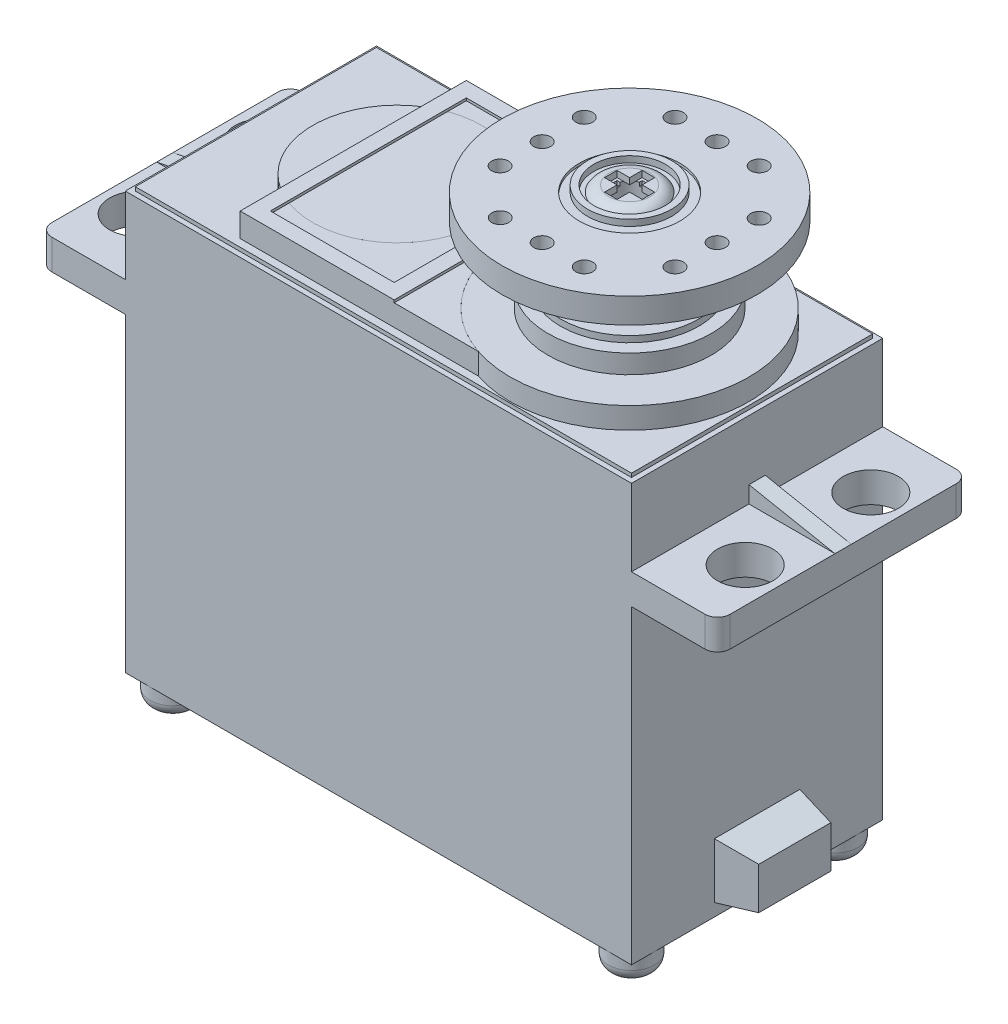
from build123d import *

# Parameters (mm, degrees)
CROQUIS1_W                    = 40.3
CROQUIS1_H                    = 20
SALIENTE_EXTRUIR1_DEPTH       = 35.5
CROQUIS2_W                    = 20
CROQUIS2_H                    = 2.4
SALIENTE_EXTRUIR2_DEPTH       = 6.85
CROQUIS3_W                    = 20
CROQUIS3_H                    = 2.4
SALIENTE_EXTRUIR3_DEPTH       = 6.85
REDONDEO1_R                   = 1
REDONDEO2_R                   = 1
REDONDEO3_R                   = 1
REDONDEO4_R                   = 1
SALIENTE_EXTRUIR4_DEPTH       = 1.5
CHAFL_N1_SIZE                 = 7.716831024
CHAFL_N1_SIZE_2               = 1.5
SALIENTE_EXTRUIR5_DEPTH       = 1.5
CHAFL_N2_SIZE                 = 1.5
CHAFL_N2_SIZE_2               = 7.716831024
CROQUIS6_R                    = 2.2
CORTAR_EXTRUIR1_DEPTH         = 2.6
CROQUIS7_R                    = 2.2
CORTAR_EXTRUIR2_DEPTH         = 2.6
CROQUIS8_W                    = 40.3
CROQUIS8_H                    = 20
CROQUIS8_W_2                  = 39.5
CROQUIS8_H_2                  = 19.2
CORTAR_EXTRUIR3_DEPTH         = 0.3
CROQUIS9_W                    = 3.8
CROQUIS9_H                    = 3.8
CORTAR_EXTRUIR4_DEPTH         = 2
REDONDEO5_R                   = 2
REDONDEO6_R                   = 2
REDONDEO7_R                   = 2
REDONDEO8_R                   = 2
CROQUIS10_R                   = 1.825
SALIENTE_EXTRUIR6_DEPTH       = 2
REDONDEO9_R                   = 1
REDONDEO10_R                  = 1
REDONDEO11_R                  = 1
REDONDEO12_R                  = 1
CORTAR_EXTRUIR5_DEPTH         = 1
CHAFL_N3_SIZE                 = 2
CHAFL_N4_SIZE                 = 2
CHAFL_N5_SIZE                 = 2
CHAFL_N6_SIZE                 = 2
SALIENTE_EXTRUIR7_DEPTH       = 2.0001
SALIENTE_EXTRUIR8_DEPTH       = 0.0001
SALIENTE_EXTRUIR8_DEPTH_BACK  = 2
CROQUIS13_R                   = 9.5
CROQUIS14_R                   = 6.5
SALIENTE_EXTRUIR9_DEPTH       = 1.5
CROQUIS15_R                   = 5.5
SALIENTE_EXTRUIR10_DEPTH      = 0.5
CROQUIS16_R                   = 2.9
SALIENTE_EXTRUIR11_DEPTH      = 4
CROQUIS17_R                   = 0.85
CORTAR_EXTRUIR6_DEPTH         = 4
CROQUIS18_W                   = 6.8
CROQUIS18_H                   = 4.4
SALIENTE_EXTRUIR12_DEPTH      = 3
CHAFL_N7_SIZE2                = 0.528980942
CHAFL_N7_SIZE                 = 3
CHAFL_N8_SIZE2                = 3
CHAFL_N8_SIZE                 = 0.528980942
CHAFL_N9_SIZE2                = 3
CHAFL_N9_SIZE                 = 0.528980942
CHAFL_N10_SIZE2               = 3
CHAFL_N10_SIZE                = 0.528980942
SALIENTE_EXTRUIR13_DEPTH      = 0.0001
SALIENTE_EXTRUIR13_DEPTH_BACK = 2
CROQUIS19_R                   = 6.714911356
CROQUIS20_W                   = 9.858170172
CROQUIS20_H                   = 15.6
SALIENTE_EXTRUIR14_DEPTH      = 0.2
SALIENTE_EXTRUIR15_DEPTH      = 2
SALIENTE_EXTRUIR15_DEPTH_BACK = 3
CROQUIS21_R                   = 4.3
SALIENTE_EXTRUIR16_DEPTH      = 0.0001
SALIENTE_EXTRUIR16_DEPTH_BACK = 2
CROQUIS22_R                   = 10.15
CROQUIS23_R                   = 1.375
CORTAR_EXTRUIR7_DEPTH         = 5.2
CROQUIS24_R                   = 3.35
CROQUIS24_R_2                 = 2.85
SALIENTE_EXTRUIR17_DEPTH      = 0.5
CHAFL_N11_SIZE                = 0.75
CROQUIS25_R                   = 2.5
SALIENTE_EXTRUIR18_DEPTH      = 0.5
REDONDEO13_R                  = 1
CROQUIS27_W                   = 1
CROQUIS27_H                   = 1
CORTAR_EXTRUIR8_DEPTH         = 1
CROQUIS28_R                   = 4
CORTAR_EXTRUIR10_DEPTH        = 0.2
CROQUIS29_R                   = 0.675
CORTAR_EXTRUIR11_DEPTH        = 2.5
CROQUIS30_R                   = 0.675
CORTAR_EXTRUIR12_DEPTH        = 2.5


# Some blends are built 0.0001 mm under size
with BuildPart() as part:
    # Croquis1 → Saliente-Extruir1 (new body)
    with BuildSketch(Plane(origin=(0, 0, 0), x_dir=(1, 0, 0), z_dir=(0, 1, 0))):
        Rectangle(CROQUIS1_W, CROQUIS1_H)
    extrude(amount=SALIENTE_EXTRUIR1_DEPTH)

    # Croquis2 → Saliente-Extruir2 (add)
    with BuildSketch(Plane(origin=(20.15, 0, 0), x_dir=(0, 0, -1), z_dir=(1, 0, 0))):
        with Locations((0, 27.9)):
            Rectangle(CROQUIS2_W, CROQUIS2_H)
    extrude(amount=SALIENTE_EXTRUIR2_DEPTH)

    # Croquis3 → Saliente-Extruir3 (add)
    with BuildSketch(Plane.ZY.offset(20.15)):
        with Locations((0, 27.9)):
            Rectangle(CROQUIS3_W, CROQUIS3_H)
    extrude(amount=SALIENTE_EXTRUIR3_DEPTH)

    # Redondeo1
    redondeo1_edges = [part.edges().sort_by_distance(p)[0] for p in [
        (27, 27.9, 10),
    ]]
    fillet(redondeo1_edges, radius=REDONDEO1_R)

    # Redondeo2
    redondeo2_edges = [part.edges().sort_by_distance(p)[0] for p in [
        (27, 27.9, -10),
    ]]
    fillet(redondeo2_edges, radius=REDONDEO2_R)

    # Redondeo3
    redondeo3_edges = [part.edges().sort_by_distance(p)[0] for p in [
        (-27, 27.9, 10),
    ]]
    fillet(redondeo3_edges, radius=REDONDEO3_R)

    # Redondeo4
    redondeo4_edges = [part.edges().sort_by_distance(p)[0] for p in [
        (-27, 27.9, -10),
    ]]
    fillet(redondeo4_edges, radius=REDONDEO4_R)

    # Croquis4 → Saliente-Extruir4 (add)
    with BuildSketch(Plane(origin=(0, 29.1, 0), x_dir=(1, 0, 0), z_dir=(0, 1, 0))):
        Polygon((20.15, 0), (20.15, 0.65), (27, 0.65), (27, 0), (27, -0.65), (20.15, -0.65), align=None)
    extrude(amount=SALIENTE_EXTRUIR4_DEPTH)

    # Chaflán1
    # the kernel refuses this chamfer: 7.716831024, 1.5 mm, written as the material it takes off along each edge
    with BuildSketch(Plane(origin=(27, 30.6, -20.700123343), x_dir=(-0.9999730339438945, 0.007343799087842641, 0), z_dir=(0, 0, 1))) as chafl_n1_piece_1_section:
        Polygon((CHAFL_N1_SIZE * 0.999973033938, CHAFL_N1_SIZE * 0.0073437990878), (-CHAFL_N1_SIZE_2 * 0.00734379908784, CHAFL_N1_SIZE_2 * 0.999973033944), (0, 0), align=None)
    chafl_n1_piece_1 = extrude(amount=41.400246686, mode=Mode.PRIVATE)
    chafl_n1_piece_1 = split(chafl_n1_piece_1, bisect_by=Plane(origin=(20.15, 30.164831882, 0), z_dir=(1, 0, 0)), keep=Keep.TOP, mode=Mode.PRIVATE)
    add(chafl_n1_piece_1, mode=Mode.SUBTRACT)

    # Croquis5 → Saliente-Extruir5 (add)
    with BuildSketch(Plane(origin=(0, 29.1, 0), x_dir=(1, 0, 0), z_dir=(0, 1, 0))):
        Polygon((-27, 0), (-27, 0.65), (-20.15, 0.65), (-20.15, 0), (-20.15, -0.65), (-27, -0.65), align=None)
    extrude(amount=SALIENTE_EXTRUIR5_DEPTH)

    # Chaflán2
    # the kernel refuses this chamfer: 7.716831024, 1.5 mm, written as the material it takes off along each edge
    with BuildSketch(Plane(origin=(-27, 30.6, 20.700123343), x_dir=(-0.19079870499623633, -0.9816291836389947, 0), z_dir=(0, 0, -1))) as chafl_n2_piece_1_section:
        Polygon((CHAFL_N2_SIZE * 0.981629183639, -CHAFL_N2_SIZE * 0.190798704996), (-CHAFL_N2_SIZE_2 * 0.190798704995, -CHAFL_N2_SIZE_2 * 0.981629183633), (0, 0), align=None)
    chafl_n2_piece_1 = extrude(amount=41.400246686, mode=Mode.PRIVATE)
    chafl_n2_piece_1 = split(chafl_n2_piece_1, bisect_by=Plane(origin=(-20.15, 30.164831882, 0), z_dir=(-1, 0, 0)), keep=Keep.TOP, mode=Mode.PRIVATE)
    add(chafl_n2_piece_1, mode=Mode.SUBTRACT)

    # Croquis6 → Cortar-Extruir1 (cut)
    with BuildSketch(Plane(origin=(0, 29.1, 0), x_dir=(1, 0, 0), z_dir=(0, 1, 0))):
        with Locations(Location((24.2, 5, 0), (0, 0, 270))):
            Circle(CROQUIS6_R)
        with Locations(Location((24.2, -5, 0), (0, 0, 270))):
            Circle(CROQUIS6_R)
    extrude(amount=-CORTAR_EXTRUIR1_DEPTH, mode=Mode.SUBTRACT)

    # Croquis7 → Cortar-Extruir2 (cut)
    with BuildSketch(Plane(origin=(0, 29.1, 0), x_dir=(1, 0, 0), z_dir=(0, 1, 0))):
        with Locations(Location((-24.2, -5, 0), (0, 0, 270))):
            Circle(CROQUIS7_R)
        with Locations(Location((-24.2, 5, 0), (0, 0, 270))):
            Circle(CROQUIS7_R)
    extrude(amount=-CORTAR_EXTRUIR2_DEPTH, mode=Mode.SUBTRACT)

    # Croquis8 → Cortar-Extruir3 (cut)
    with BuildSketch(Plane(origin=(0, 35.5, 0), x_dir=(1, 0, 0), z_dir=(0, 1, 0))):
        Rectangle(CROQUIS8_W, CROQUIS8_H)
        Rectangle(CROQUIS8_W_2, CROQUIS8_H_2, mode=Mode.SUBTRACT)
    extrude(amount=-CORTAR_EXTRUIR3_DEPTH, mode=Mode.SUBTRACT)

    # Croquis9 → Cortar-Extruir4 (cut)
    with BuildSketch(Plane.XZ):
        with Locations((-18.25, -8.1)):
            Rectangle(CROQUIS9_W, CROQUIS9_H)
        with Locations((-18.25, 8.1)):
            Rectangle(CROQUIS9_W, CROQUIS9_H)
        with Locations((18.25, 8.1)):
            Rectangle(CROQUIS9_W, CROQUIS9_H)
        with Locations((18.25, -8.1)):
            Rectangle(CROQUIS9_W, CROQUIS9_H)
    extrude(amount=-CORTAR_EXTRUIR4_DEPTH, mode=Mode.SUBTRACT)

    # Redondeo5
    redondeo5_edges = [part.edges().sort_by_distance(p)[0] for p in [
        (-16.35, 1, -6.2),
    ]]
    fillet(redondeo5_edges, radius=REDONDEO5_R)

    # Redondeo6
    redondeo6_edges = [part.edges().sort_by_distance(p)[0] for p in [
        (-16.35, 1, 6.2),
    ]]
    fillet(redondeo6_edges, radius=REDONDEO6_R)

    # Redondeo7
    redondeo7_edges = [part.edges().sort_by_distance(p)[0] for p in [
        (16.35, 1, 6.2),
    ]]
    fillet(redondeo7_edges, radius=REDONDEO7_R)

    # Redondeo8
    redondeo8_edges = [part.edges().sort_by_distance(p)[0] for p in [
        (16.35, 1, -6.2),
    ]]
    fillet(redondeo8_edges, radius=REDONDEO8_R)

    # Croquis10 → Saliente-Extruir6 (add)
    with BuildSketch(Plane.XZ.offset(-2)):
        with Locations(Location((-18.25, 8.1, 0), (0, 0, 270))):
            Circle(CROQUIS10_R)
        with Locations(Location((-18.25, -8.1, 0), (0, 0, 90))):
            Circle(CROQUIS10_R)
        with Locations(Location((18.25, -8.1, 0), (0, 0, 90))):
            Circle(CROQUIS10_R)
        with Locations(Location((18.25, 8.1, 0), (0, 0, 270))):
            Circle(CROQUIS10_R)
    extrude(amount=SALIENTE_EXTRUIR6_DEPTH)

    # Redondeo9
    redondeo9_edges = [part.edges().sort_by_distance(p)[0] for p in [
        (-18.25, 0, -9.925),
    ]]
    fillet(redondeo9_edges, radius=REDONDEO9_R)

    # Redondeo10
    redondeo10_edges = [part.edges().sort_by_distance(p)[0] for p in [
        (-18.25, 0, 9.925),
    ]]
    fillet(redondeo10_edges, radius=REDONDEO10_R)

    # Redondeo11
    redondeo11_edges = [part.edges().sort_by_distance(p)[0] for p in [
        (18.25, 0, -9.925),
    ]]
    fillet(redondeo11_edges, radius=REDONDEO11_R)

    # Redondeo12
    redondeo12_edges = [part.edges().sort_by_distance(p)[0] for p in [
        (18.25, 0, 9.925),
    ]]
    fillet(redondeo12_edges, radius=REDONDEO12_R)

    # Croquis11 → Cortar-Extruir5 (cut)
    with BuildSketch(Plane.XZ):
        Polygon((-18.75, -9.35), (-17.75, -9.35), (-17.75, -8.6), (-17, -8.6), (-17, -7.6), (-17.75, -7.6), (-17.75, -6.85), (-18.75, -6.85), (-18.75, -7.6), (-19.5, -7.6), (-19.5, -8.6), (-18.75, -8.6), align=None)
        Polygon((-18.75, 9.35), (-17.75, 9.35), (-17.75, 8.6), (-17, 8.6), (-17, 7.6), (-17.75, 7.6), (-17.75, 6.85), (-18.75, 6.85), (-18.75, 7.6), (-19.5, 7.6), (-19.5, 8.6), (-18.75, 8.6), align=None)
        Polygon((18.75, 6.85), (17.75, 6.85), (17.75, 7.6), (17, 7.6), (17, 8.6), (17.75, 8.6), (17.75, 9.35), (18.75, 9.35), (18.75, 8.6), (19.5, 8.6), (19.5, 7.6), (18.75, 7.6), align=None)
        Polygon((18.75, -6.85), (17.75, -6.85), (17.75, -7.6), (17, -7.6), (17, -8.6), (17.75, -8.6), (17.75, -9.35), (18.75, -9.35), (18.75, -8.6), (19.5, -8.6), (19.5, -7.6), (18.75, -7.6), align=None)
    extrude(amount=-CORTAR_EXTRUIR5_DEPTH, mode=Mode.SUBTRACT)

    # Chaflán3
    chafl_n3_edges = [part.edges().sort_by_distance(p)[0] for p in [
        (0, 0, -10),
    ]]
    chamfer(chafl_n3_edges, length=CHAFL_N3_SIZE)

    # Chaflán4
    chafl_n4_edges = [part.edges().sort_by_distance(p)[0] for p in [
        (20.15, 0, 0),
    ]]
    chamfer(chafl_n4_edges, length=CHAFL_N4_SIZE)

    # Chaflán5
    chafl_n5_edges = [part.edges().sort_by_distance(p)[0] for p in [
        (0, 0, 10),
    ]]
    chamfer(chafl_n5_edges, length=CHAFL_N5_SIZE)

    # Chaflán6
    chafl_n6_edges = [part.edges().sort_by_distance(p)[0] for p in [
        (-20.15, 0, 0),
    ]]
    chamfer(chafl_n6_edges, length=CHAFL_N6_SIZE)

    # Croquis12 → Saliente-Extruir7 (add)
    with BuildSketch(Plane(origin=(0, 35.2, 0), x_dir=(1, 0, 0), z_dir=(0, 1, 0))):
        Polygon((0, 9), (-12, 9), (-12, -9), (0, -9), (10, -9), (10, 9), align=None)
    extrude(amount=SALIENTE_EXTRUIR7_DEPTH)

    # Croquis13 → Saliente-Extruir8 (add, two sides: drawn at the far end of the back side and taken through both)
    with BuildSketch(Plane(origin=(0, 37.2001, 0), x_dir=(1, 0, 0), z_dir=(0, 1, 0)).offset(-SALIENTE_EXTRUIR8_DEPTH_BACK)):
        with Locations(Location((10, 0, 0), (0, 0, 270))):
            Circle(CROQUIS13_R)
    extrude(amount=SALIENTE_EXTRUIR8_DEPTH + SALIENTE_EXTRUIR8_DEPTH_BACK)

    # Croquis14 → Saliente-Extruir9 (add)
    with BuildSketch(Plane(origin=(0, 37.2002, 0), x_dir=(1, 0, 0), z_dir=(0, 1, 0))):
        with Locations(Location((10, 0, 0), (0, 0, 270))):
            Circle(CROQUIS14_R)
    extrude(amount=SALIENTE_EXTRUIR9_DEPTH)

    # Croquis15 → Saliente-Extruir10 (add)
    with BuildSketch(Plane(origin=(0, 38.7002, 0), x_dir=(1, 0, 0), z_dir=(0, 1, 0))):
        with Locations(Location((10, 0, 0), (0, 0, 270))):
            Circle(CROQUIS15_R)
    extrude(amount=SALIENTE_EXTRUIR10_DEPTH)

    # Croquis16 → Saliente-Extruir11 (add)
    with BuildSketch(Plane(origin=(0, 39.2002, 0), x_dir=(1, 0, 0), z_dir=(0, 1, 0))):
        with Locations(Location((10, 0, 0), (0, 0, 270))):
            Circle(CROQUIS16_R)
    extrude(amount=SALIENTE_EXTRUIR11_DEPTH)

    # Croquis17 → Cortar-Extruir6 (cut)
    with BuildSketch(Plane(origin=(0, 43.2002, 0), x_dir=(1, 0, 0), z_dir=(0, 1, 0))):
        with Locations(Location((10, 0, 0), (0, 0, 270))):
            Circle(CROQUIS17_R)
    extrude(amount=-CORTAR_EXTRUIR6_DEPTH, mode=Mode.SUBTRACT)

    # Croquis18 → Saliente-Extruir12 (add)
    with BuildSketch(Plane(origin=(20.15, 0, 0), x_dir=(0, 0, -1), z_dir=(1, 0, 0))):
        with Locations((0, 5.2)):
            Rectangle(CROQUIS18_W, CROQUIS18_H)
    extrude(amount=SALIENTE_EXTRUIR12_DEPTH)

    # Chaflán7
    chafl_n7_edges = [part.edges().sort_by_distance(p)[0] for p in [
        (23.15, 7.4, 0),
    ]]
    chafl_n7_side = [part.faces().sort_by_distance(p)[0] for p in [
        (23.139420381, 7.4, 0),
    ]]
    chamfer(chafl_n7_edges, length=CHAFL_N7_SIZE - 0.0001, length2=CHAFL_N7_SIZE2 - 0.0001, reference=chafl_n7_side[0])  # a hair under: the kernel refuses the full size

    # Chaflán8
    chafl_n8_edges = [part.edges().sort_by_distance(p)[0] for p in [
        (23.15, 3, 0),
    ]]
    chafl_n8_side = [part.faces().sort_by_distance(p)[0] for p in [
        (23.15, 3.010579619, 0),
    ]]
    chamfer(chafl_n8_edges, length=CHAFL_N8_SIZE - 0.0001, length2=CHAFL_N8_SIZE2 - 0.0001, reference=chafl_n8_side[0])  # a hair under: the kernel refuses the full size

    # Chaflán9
    chafl_n9_edges = [part.edges().sort_by_distance(p)[0] for p in [
        (23.15, 5.2, -3.4),
    ]]
    chafl_n9_side = [part.faces().sort_by_distance(p)[0] for p in [
        (23.15, 5.2, -3.389420381),
    ]]
    chamfer(chafl_n9_edges, length=CHAFL_N9_SIZE - 0.0001, length2=CHAFL_N9_SIZE2 - 0.0001, reference=chafl_n9_side[0])  # a hair under: the kernel refuses the full size

    # Chaflán10
    chafl_n10_edges = [part.edges().sort_by_distance(p)[0] for p in [
        (23.15, 5.2, 3.4),
    ]]
    chafl_n10_side = [part.faces().sort_by_distance(p)[0] for p in [
        (23.15, 5.2, 3.389420381),
    ]]
    chamfer(chafl_n10_edges, length=CHAFL_N10_SIZE - 0.0001, length2=CHAFL_N10_SIZE2 - 0.0001, reference=chafl_n10_side[0])  # a hair under: the kernel refuses the full size

    # Croquis19 → Saliente-Extruir13 (add, two sides: drawn at the far end of the back side and taken through both)
    with BuildSketch(Plane(origin=(0, 37.2001, 0), x_dir=(1, 0, 0), z_dir=(0, 1, 0)).offset(-SALIENTE_EXTRUIR13_DEPTH_BACK)):
        with Locations(Location((-8.5, 0, 0), (0, 0, 270))):
            Circle(CROQUIS19_R)
    extrude(amount=SALIENTE_EXTRUIR13_DEPTH + SALIENTE_EXTRUIR13_DEPTH_BACK)

    # Croquis20 → Saliente-Extruir14 (add)
    with BuildSketch(Plane(origin=(0, 37.2001, 0), x_dir=(1, 0, 0), z_dir=(0, 1, 0))):
        Polygon((0.258170172, -7.8), (0.258170172, -9), (-0.941829828, -9), (-12, -9), (-12, -7.8), (-12, 7.8), (-12, 9), (-0.941829828, 9), (0.258170172, 9), (0.258170172, 7.8), align=None)
        with Locations((-5.870914914, 0)):
            Rectangle(CROQUIS20_W, CROQUIS20_H, mode=Mode.SUBTRACT)
    extrude(amount=SALIENTE_EXTRUIR14_DEPTH)

    # Croquis21 → Saliente-Extruir15 (add, two sides: drawn at the far end of the back side and taken through both)
    with BuildSketch(Plane(origin=(0, 43.2002, 0), x_dir=(1, 0, 0), z_dir=(0, 1, 0)).offset(-SALIENTE_EXTRUIR15_DEPTH_BACK)):
        with Locations(Location((10, 0, 0), (0, 0, 270))):
            Circle(CROQUIS21_R)
    extrude(amount=SALIENTE_EXTRUIR15_DEPTH + SALIENTE_EXTRUIR15_DEPTH_BACK)

    # Croquis22 → Saliente-Extruir16 (add, two sides: drawn at the far end of the back side and taken through both)
    with BuildSketch(Plane(origin=(0, 45.2002, 0), x_dir=(1, 0, 0), z_dir=(0, 1, 0)).offset(-SALIENTE_EXTRUIR16_DEPTH_BACK)):
        with Locations(Location((10, 0, 0), (0, 0, 270))):
            Circle(CROQUIS22_R)
    extrude(amount=SALIENTE_EXTRUIR16_DEPTH + SALIENTE_EXTRUIR16_DEPTH_BACK)

    # Croquis23 → Cortar-Extruir7 (cut)
    with BuildSketch(Plane(origin=(0, 45.2003, 0), x_dir=(1, 0, 0), z_dir=(0, 1, 0))):
        with Locations(Location((10, 0, 0), (0, 0, 270))):
            Circle(CROQUIS23_R)
    extrude(amount=-CORTAR_EXTRUIR7_DEPTH, mode=Mode.SUBTRACT)

    # Croquis24 → Saliente-Extruir17 (add)
    with BuildSketch(Plane(origin=(0, 45.2003, 0), x_dir=(1, 0, 0), z_dir=(0, 1, 0))):
        with Locations(Location((10, 0, 0), (0, 0, 270))):
            Circle(CROQUIS24_R)
        with Locations(Location((10, 0, 0), (0, 0, 270))):
            Circle(CROQUIS24_R_2, mode=Mode.SUBTRACT)
    extrude(amount=SALIENTE_EXTRUIR17_DEPTH)

    # Chaflán11
    chafl_n11_edges = [part.edges().sort_by_distance(p)[0] for p in [
        (10, 40.2002, -4.3),
    ]]
    chamfer(chafl_n11_edges, length=CHAFL_N11_SIZE)

    # Croquis25 → Saliente-Extruir18 (add)
    with BuildSketch(Plane(origin=(0, 45.2003, 0), x_dir=(1, 0, 0), z_dir=(0, 1, 0))):
        with Locations(Location((10, 0, 0), (0, 0, 270))):
            Circle(CROQUIS25_R)
    extrude(amount=SALIENTE_EXTRUIR18_DEPTH)

    # Redondeo13
    # the kernel refuses this fillet: 1 mm, written as the material it takes off along each edge
    with BuildSketch(Plane(origin=(10, 45.7003, 0), x_dir=(0, 0, 1), z_dir=(-1, 0, 0))) as redondeo13_piece_1:
        with BuildLine():
            CenterArc((1.633974596, -1), REDONDEO13_R, 30, 60)
            Line((1.633974596, 0), (1.633974596, 0.02))
            Line((1.633974596, 0.02), (2.5, 0.02))
            Line((2.5, 0.02), (2.52, 0))
            ThreePointArc((2.52, 0), (2.52, -0.25), (2.517320508, -0.49))
            Line((2.517320508, -0.49), (2.5, -0.5))
        make_face()
    revolve(axis=Axis((10, 45.7003, 0), (0, 1, 0)), mode=Mode.SUBTRACT)

    # Croquis27 → Cortar-Extruir8 (cut)
    with BuildSketch(Plane(origin=(0, 45.7003, 0), x_dir=(1, 0, 0), z_dir=(0, 1, 0))):
        with Locations((10, 1)):
            Rectangle(CROQUIS27_W, CROQUIS27_H)
        with Locations((10, 0)):
            Rectangle(CROQUIS27_W, CROQUIS27_H)
        with Locations((10, -1)):
            Rectangle(CROQUIS27_W, CROQUIS27_H)
        with Locations((9, 0)):
            Rectangle(CROQUIS27_W, CROQUIS27_H)
        with Locations((11, 0)):
            Rectangle(CROQUIS27_W, CROQUIS27_H)
    extrude(amount=-CORTAR_EXTRUIR8_DEPTH, mode=Mode.SUBTRACT)

    # Croquis28 → Cortar-Extruir10 (cut)
    with BuildSketch(Plane(origin=(0, 45.2003, 0), x_dir=(1, 0, 0), z_dir=(0, 1, 0))):
        with Locations(Location((10, 0, 0), (0, 0, 270))):
            Circle(CROQUIS28_R)
    extrude(amount=-CORTAR_EXTRUIR10_DEPTH, mode=Mode.SUBTRACT)


with BuildPart() as cortar_extruir10_piece_1:
    # of the separate pieces the step leaves, piece 1, a body of its own (cortar_extruir10_pieces)
    add(part.part.solids().sort_by_distance((10, 40.2002, 3.55))[0])

    # Croquis29 → Cortar-Extruir11 (cut)
    with BuildSketch(Plane(origin=(0, 45.2003, 0), x_dir=(1, 0, 0), z_dir=(0, 1, 0))):
        with Locations(Location((3.0375, 0, 0), (0, 0, 270))):
            Circle(CROQUIS29_R)
        with Locations(Location((10, 6.9625, 0), (0, 0, 270))):
            Circle(CROQUIS29_R)
        with Locations(Location((16.9625, 0, 0), (0, 0, 270))):
            Circle(CROQUIS29_R)
        with Locations(Location((10, -6.9625, 0), (0, 0, 270))):
            Circle(CROQUIS29_R)
    extrude(amount=-CORTAR_EXTRUIR11_DEPTH, mode=Mode.SUBTRACT)

    # Croquis30 → Cortar-Extruir12 (cut)
    with BuildSketch(Plane(origin=(0, 45.2003, 0), x_dir=(1, 0, 0), z_dir=(0, 1, 0))):
        with Locations(Location((6.65, 6.9625, 0), (0, 0, 270))):
            Circle(CROQUIS30_R)
        with Locations(Location((13.35, 6.9625, 0), (0, 0, 270))):
            Circle(CROQUIS30_R)
        with Locations(Location((3.0375, 3.35, 0), (0, 0, 270))):
            Circle(CROQUIS30_R)
        with Locations(Location((3.0375, -3.35, 0), (0, 0, 270))):
            Circle(CROQUIS30_R)
        with Locations(Location((6.611283357, -6.911330196, 0), (0, 0, 270))):
            Circle(CROQUIS30_R)
        with Locations(Location((13.35, -6.9625, 0), (0, 0, 270))):
            Circle(CROQUIS30_R)
        with Locations(Location((16.9625, -3.35, 0), (0, 0, 270))):
            Circle(CROQUIS30_R)
        with Locations(Location((16.9625, 3.35, 0), (0, 0, 270))):
            Circle(CROQUIS30_R)
    extrude(amount=-CORTAR_EXTRUIR12_DEPTH, mode=Mode.SUBTRACT)


with BuildPart() as cortar_extruir10_piece_2:
    # of the separate pieces the step leaves, piece 2, a body of its own (cortar_extruir10_pieces)
    add(part.part.solids().sort_by_distance((10, 45.2003, 2.5))[0])


with BuildPart() as cortar_extruir10_piece_3:
    # of the separate pieces the step leaves, piece 3, a body of its own (cortar_extruir10_pieces)
    add(part.part.solids().sort_by_distance((10, 45.2003, 3.35))[0])


solid = Compound([cortar_extruir10_piece_1.part, cortar_extruir10_piece_2.part, cortar_extruir10_piece_3.part])
